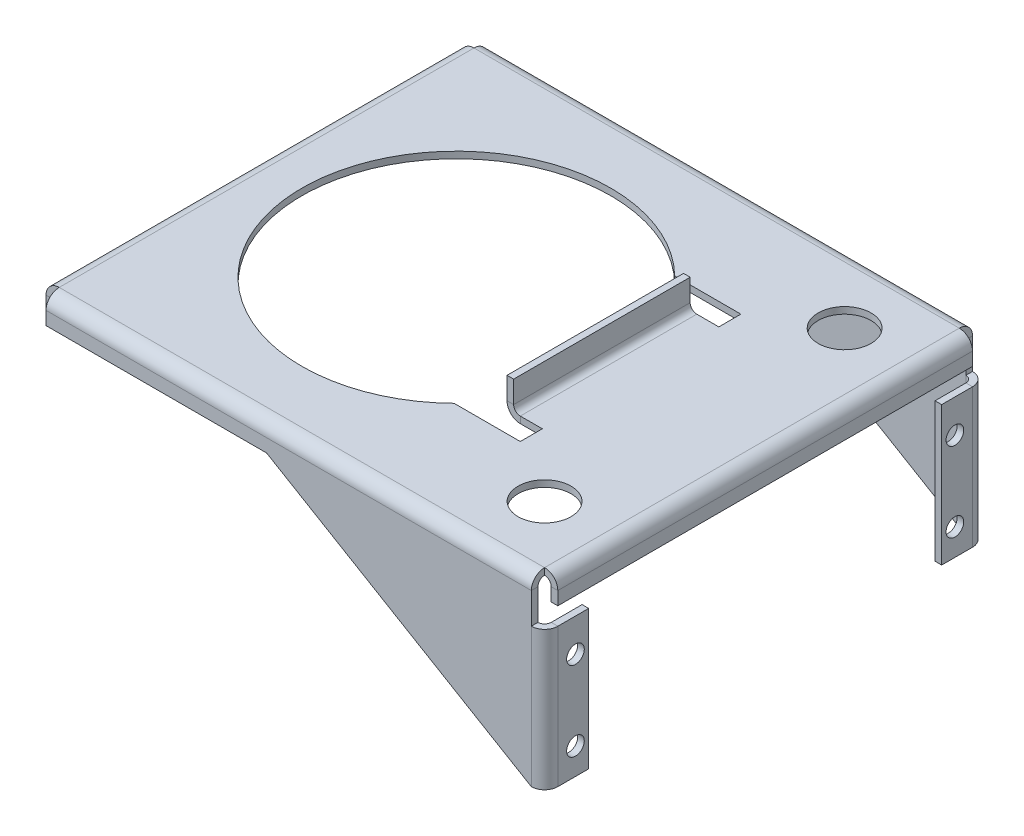
from build123d import *

# Parameters (mm, degrees)
SKETCH1_W                    = 110
SKETCH1_H                    = 100
BASE_FLANGE1_DEPTH           = 1.5
EDGE_FLANGE1_STRIP_W         = 9
EDGE_FLANGE1_STRIP_H         = 1.5
EDGE_FLANGE1_STRIP_CUT_DEPTH = 110
EDGE_FLANGE1_DEPTH           = 110
EDGE_FLANGE1_FLAT_DEPTH      = 1.5
EDGE_FLANGE2_DEPTH           = 31.5
F_4_0_4_DIAMETER_HOLE1_D     = 4
EDGE_FLANGE3_DEPTH           = 94
EDGE_FLANGE3_BEND_DEPTH      = 94
F_12_0_12_DIAMETER_HOLE1_D   = 12
EDGE_FLANGE4_STRIP_W         = 9
EDGE_FLANGE4_STRIP_H         = 1.5
EDGE_FLANGE4_STRIP_CUT_DEPTH = 40
EDGE_FLANGE4_DEPTH           = 40


# Sheet-metal steps are written as plain solids
with BuildPart() as part:
    # Sketch1 → Base-Flange1 (new body)
    with BuildSketch(Plane(origin=(0, 0, 0), x_dir=(1, 0, 0), z_dir=(0, 1, 0))):
        with Locations((12, 0)):
            Rectangle(SKETCH1_W, SKETCH1_H)
        with BuildLine():
            Line((24.494897428, -25), (39.494897428, -25))
            Line((39.494897428, -25), (39.494897428, -20))
            Line((39.494897428, -20), (31.494897428, -20))
            Line((31.494897428, -20), (31.494897428, 20))
            Line((31.494897428, 20), (39.494897428, 20))
            Line((39.494897428, 20), (39.494897428, 25))
            Line((39.494897428, 25), (24.494897428, 25))
            ThreePointArc((24.494897428, 25), (-35, 0), (24.494897428, -25))
        make_face(mode=Mode.SUBTRACT)
    extrude(amount=-BASE_FLANGE1_DEPTH)

    # Edge-Flange1 strip (across the edge) → Edge-Flange1 strip cut (cut)
    with BuildSketch(Plane(origin=(67, -1.5, 50), x_dir=(0, 0, -1), z_dir=(-1, 0, 0))):
        with Locations((-1.5, -0.75)):
            Rectangle(EDGE_FLANGE1_STRIP_W, EDGE_FLANGE1_STRIP_H)
    edge_flange1_strip_cut = extrude(amount=EDGE_FLANGE1_STRIP_CUT_DEPTH, mode=Mode.SUBTRACT)

    # Edge-Flange1 bend section (across the edge) → Edge-Flange1 (add)
    with BuildSketch(Plane(origin=(67, -1.5, 50), x_dir=(0, 0, -1), z_dir=(-1, 0, 0))):
        with BuildLine():
            Line((0, 1.5), (1.5, 1.5))
            ThreePointArc((1.5, 1.5), (1.939339828, 0.439339828), (3, 0))
            Line((3, 0), (3, -1.5))
            ThreePointArc((3, -1.5), (0.878679656, -0.621320344), (0, 1.5))
        make_face()
    edge_flange1 = extrude(amount=EDGE_FLANGE1_DEPTH)

    # Edge-Flange1 profile (on flange) → Edge-Flange1 flat (add)
    with BuildSketch(Plane(origin=(0, -1.5, 50), x_dir=(1, 0, 0), z_dir=(0, 0, -1))):
        Polygon((-43, 1.5), (67, 1.5), (67, 40), (7, 4.5), (-43, 4.5), align=None)
    edge_flange1_flat = extrude(amount=EDGE_FLANGE1_FLAT_DEPTH)

    # Edge-Flange2 section (across the edge) → Edge-Flange2 (add)
    with BuildSketch(Plane(origin=(68.5, -10, 48.5), x_dir=(-1, 0, 0), z_dir=(0, -1, 0))):
        with BuildLine():
            Line((-1.5, 1.5), (-1.5, 8.5))
            Line((-1.5, 8.5), (0, 8.5))
            Line((0, 8.5), (0, 1.5))
            ThreePointArc((0, 1.5), (0.439339828, 0.439339828), (1.5, 0))
            Line((1.5, 0), (1.5, -1.5))
            ThreePointArc((1.5, -1.5), (-0.621320344, -0.621320344), (-1.5, 1.5))
        make_face()
    edge_flange2 = extrude(amount=EDGE_FLANGE2_DEPTH)

    # Ø4.0 (4) Diameter Hole1 (through all)
    with Locations(Plane(origin=(70, 0, 0), x_dir=(0, 0, -1), z_dir=(1, 0, 0))):
        with Locations((-43, -17.5), (-43, -35.5)):
            f_4_0_4_diameter_hole1 = Hole(F_4_0_4_DIAMETER_HOLE1_D / 2)

    # Mirror1: Edge-Flange1 strip cut, Edge-Flange1, Edge-Flange1 flat, Edge-Flange2, Ø4.0 (4) Diameter Hole1 across plane
    add(edge_flange1_strip_cut.mirror(Plane.XY), mode=Mode.SUBTRACT)
    add(edge_flange1.mirror(Plane.XY))
    add(edge_flange1_flat.mirror(Plane.XY))
    add(edge_flange2.mirror(Plane.XY))
    add(f_4_0_4_diameter_hole1.mirror(Plane.XY), mode=Mode.SUBTRACT)

    # Edge-Flange3 section (across the edge) → Edge-Flange3 (add)
    with BuildSketch(Plane(origin=(68.5, -1.5, -47), x_dir=(-1, 0, 0), z_dir=(0, 0, 1))):
        with BuildLine():
            Line((-1.5, 1.5), (-1.5, 4.5))
            Line((-1.5, 4.5), (0, 4.5))
            Line((0, 4.5), (0, 1.5))
            ThreePointArc((0, 1.5), (0.439339828, 0.439339828), (1.5, 0))
            Line((1.5, 0), (1.5, -1.5))
            ThreePointArc((1.5, -1.5), (-0.621320344, -0.621320344), (-1.5, 1.5))
        make_face()
    extrude(amount=EDGE_FLANGE3_DEPTH)

    # Edge-Flange3 section 2 (across the edge) → Edge-Flange3 bend (add)
    with BuildSketch(Plane(origin=(-44.5, -1.5, 47), x_dir=(1, 0, 0), z_dir=(0, 0, -1))):
        with BuildLine():
            Line((-1.5, 1.5), (-1.5, 4.5))
            Line((-1.5, 4.5), (0, 4.5))
            Line((0, 4.5), (0, 1.5))
            ThreePointArc((0, 1.5), (0.439339828, 0.439339828), (1.5, 0))
            Line((1.5, 0), (1.5, -1.5))
            ThreePointArc((1.5, -1.5), (-0.621320344, -0.621320344), (-1.5, 1.5))
        make_face()
    extrude(amount=EDGE_FLANGE3_BEND_DEPTH)

    # Ø12.0 (12) Diameter Hole1 (through all)
    with Locations(Plane(origin=(0, 0, 0), x_dir=(1, 0, 0), z_dir=(0, 1, 0))):
        with Locations((54, 34), (54, -34)):
            Hole(F_12_0_12_DIAMETER_HOLE1_D / 2)

    # Edge-Flange4 strip (across the edge) → Edge-Flange4 strip cut (cut)
    with BuildSketch(Plane(origin=(31.494897428, 0, -20), x_dir=(1, 0, 0), z_dir=(0, 0, 1))):
        with Locations((-1.5, -0.75)):
            Rectangle(EDGE_FLANGE4_STRIP_W, EDGE_FLANGE4_STRIP_H)
    extrude(amount=EDGE_FLANGE4_STRIP_CUT_DEPTH, mode=Mode.SUBTRACT)

    # Edge-Flange4 section (across the edge) → Edge-Flange4 (add)
    with BuildSketch(Plane(origin=(31.494897428, 0, -20), x_dir=(1, 0, 0), z_dir=(0, 0, 1))):
        with BuildLine():
            Line((0, 1.5), (0, 6.5))
            Line((0, 6.5), (1.5, 6.5))
            Line((1.5, 6.5), (1.5, 1.5))
            ThreePointArc((1.5, 1.5), (1.939339828, 0.439339828), (3, 0))
            Line((3, 0), (3, -1.5))
            ThreePointArc((3, -1.5), (0.878679656, -0.621320344), (0, 1.5))
        make_face()
    extrude(amount=EDGE_FLANGE4_DEPTH)


solid = part.part
